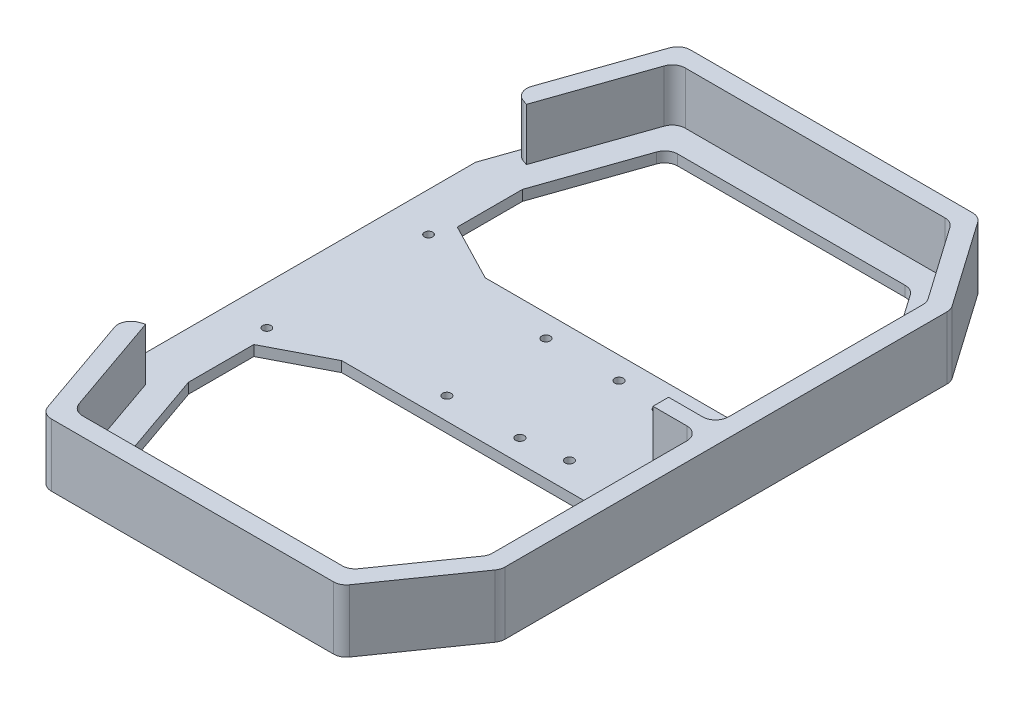
from build123d import *

# Parameters (mm, degrees)
SKETCH1_R           = 1.5999999999999992
SKETCH1_R_2         = 1.6
BOSS_EXTRUDE1_DEPTH = 2
BOSS_EXTRUDE2_DEPTH = 20
FILLET1_R           = 5
SKETCH2_R           = 1.6500000000000017
CUT_EXTRUDE1_DEPTH  = 191.86971996626394


with BuildPart() as part:
    # Sketch1 → Boss-Extrude1 (new, symmetric)
    with BuildSketch(Plane(origin=(0, 0, 0), x_dir=(1, 0, 0), z_dir=(0, 1, 0))):
        Polygon((-15, -39), (-15, 39), (-14.999999999999993, 64), (5.358274547724965, 122.5), (119.64234676884817, 122.50000000000003), (145.00000000000003, 86.28551808227317), (145.00000000000003, -86.28551808227317), (119.64234676884817, -122.50000000000003), (5.358274547725049, -122.49999999999999), (-14.999999999999993, -64), align=None)
        with Locations((0, 31)):
            Circle(SKETCH1_R, mode=Mode.SUBTRACT)
        with Locations((0, -31)):
            Circle(SKETCH1_R_2, mode=Mode.SUBTRACT)
        Polygon((25.197972880423116, 27.499999999999996), (128, 27.499999999999996), (128, 80.92543867133034), (110.7927069094685, 105.50000000000004), (17.442194764625423, 105.50000000000001), (3.0000000000000027, 64), (3.0000000000000027, 39), align=None, mode=Mode.SUBTRACT)
        Polygon((25.197972880423116, -27.499999999999996), (128, -27.499999999999996), (128, -80.92543867133034), (110.7927069094685, -105.50000000000004), (17.442194764625537, -105.49999999999999), (3.0000000000000027, -64), (3.0000000000000027, -39), align=None, mode=Mode.SUBTRACT)
    extrude(amount=BOSS_EXTRUDE1_DEPTH, both=True)

    # Sketch3 → Boss-Extrude2 (add)
    with BuildSketch(Plane(origin=(0, 2, 0), x_dir=(1, 0, 0), z_dir=(0, 1, 0))):
        Polygon((120.00000000000004, -2.999999999999993), (120.00000000000004, 3.0000000000000075), (138, 3.0000000000000075), (138, 84.07842656012029), (115.99837741498601, 115.49999999999999), (10.334006401742785, 115.49999999999997), (-4.464169294218266, 72.97708008435012), (-11.07528040532939, 75.27777777777771), (5.358274547724965, 122.5), (119.64234676884817, 122.50000000000003), (145.00000000000003, 86.28551808227317), (145.00000000000003, -86.28551808227317), (119.64234676884817, -122.50000000000003), (5.358274547724965, -122.5), (-11.075280405329384, -75.27777777777771), (-4.464169294218257, -72.97708008435012), (10.334006401742798, -115.49999999999997), (115.99837741498602, -115.49999999999996), (138, -84.07842656012026), (138, -2.999999999999991), align=None)
    extrude(amount=BOSS_EXTRUDE2_DEPTH)

    # Fillet1
    fillet1_edges = [part.edges().sort_by_distance(p)[0] for p in [
        (-11.075280405329384, 12, 75.27777777777771),
        (119.64234676884817, 10, -122.50000000000003),
        (145.00000000000003, 10, -86.28551808227317),
        (145.00000000000003, 10, 86.28551808227317),
        (119.64234676884817, 10, 122.50000000000003),
        (5.358274547725006, 10, 122.5),
        (5.358274547724965, 10, -122.5),
        (-11.07528040532939, 12, -75.27777777777771),
        (10.334006401742798, 12, 115.49999999999997),
        (115.99837741498602, 12, 115.49999999999996),
        (138, 12, 84.07842656012026),
        (138, 12, 2.999999999999991),
        (138, 12, -3.0000000000000075),
        (17.442194764625423, 0, -105.50000000000001),
        (128, 0, -80.92543867133034),
        (110.7927069094685, 0, -105.50000000000004),
        (138, 12, -84.07842656012029),
        (115.99837741498601, 12, -115.49999999999999),
        (10.334006401742785, 12, -115.49999999999997),
    ]]
    fillet(fillet1_edges, radius=FILLET1_R)

    # Sketch2 → Cut-Extrude1 (cut, through all)
    with BuildSketch(Plane(origin=(0, 2, 0), x_dir=(1, 0, 0), z_dir=(0, 1, 0))):
        with Locations((56.999999999999964, 18.99999999999999)):
            Circle(SKETCH2_R)
        with Locations((84.99999999999997, 18.999999999999993)):
            Circle(SKETCH2_R)
        with Locations((101.99999999999999, 16.999999999999996)):
            Circle(SKETCH2_R)
        with Locations((101.99999999999999, -16.999999999999996)):
            Circle(SKETCH2_R)
        with Locations((84.99999999999997, -18.999999999999993)):
            Circle(SKETCH2_R)
        with Locations((56.999999999999964, -18.99999999999999)):
            Circle(SKETCH2_R)
    extrude(amount=-CUT_EXTRUDE1_DEPTH, mode=Mode.SUBTRACT)


solid = part.part
